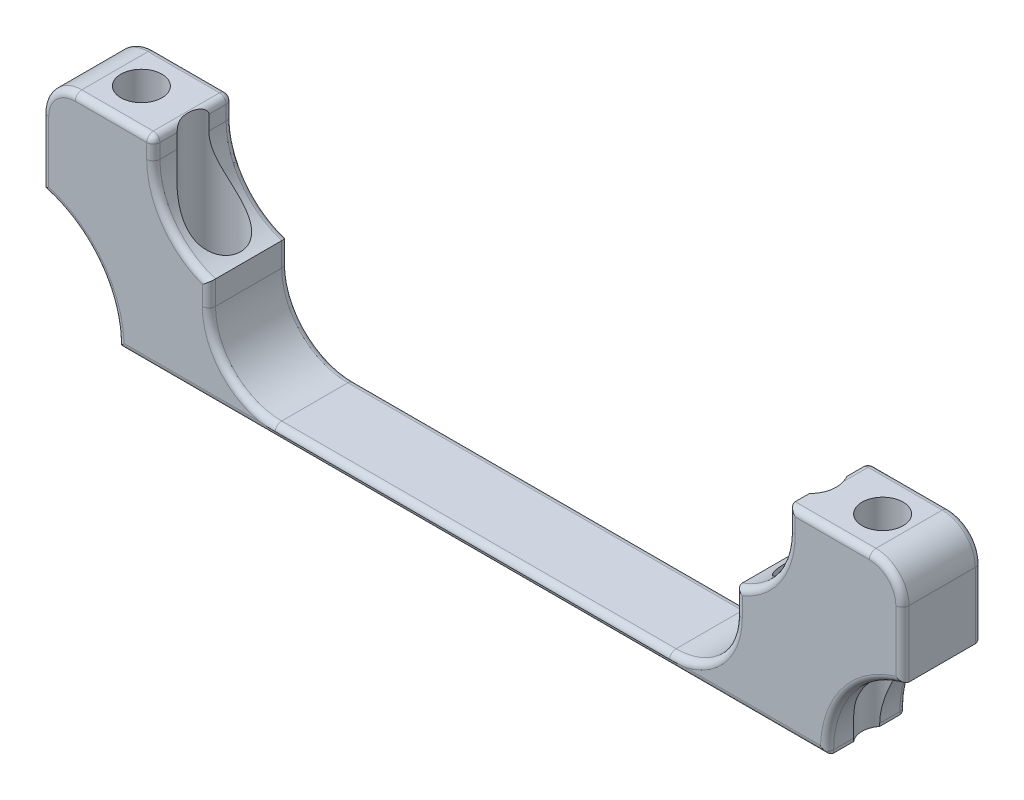
from build123d import *

# Parameters (mm, degrees)
SKETCH1_W           = 65
SKETCH1_H           = 6
SKETCH1_R           = 2
BOSS_EXTRUDE1_DEPTH = 15
SKETCH2_R           = 1.55
CUT_EXTRUDE1_DEPTH  = 36.920050111
SKETCH6_W           = 5.7
SKETCH6_H           = 7.5
SKETCH6_W_2         = 39.8
SKETCH6_H_2         = 6.8
CUT_EXTRUDE3_DEPTH  = 37.293938888
FILLET3_START       = 2.0000001
FILLET3_DEPTH       = 0.9999999
FILLET3_START_2     = -3
FILLET3_2_DEPTH     = 0.999999657
FILLET3_START_3     = -2.000000343
FILLET3_3_DEPTH     = 4.000000443
FILLET3_START_4     = 7.679241554
FILLET3_4_DEPTH     = 5.723635209
FILLET5_START       = 1.550000911
FILLET5_DEPTH       = 1.449999089
FILLET5_START_2     = -3
FILLET5_2_DEPTH     = 1.449996464
FILLET5_3_DEPTH     = 1.450229695
FILLET5_START_3     = -1.549770305
FILLET5_4_DEPTH     = 3.099771216
FILLET5_START_4     = -1.550003536
FILLET5_5_DEPTH     = 0.000233231
FILLET5_START_5     = -1e-07
FILLET5_6_DEPTH     = 7.5000001
FILLET9_R           = 5
FILLET10_R          = 2.5
FILLET11_R          = 0.5
FILLET13_R          = 0.5


with BuildPart() as part:
    # Sketch1 → Boss-Extrude1 (new body)
    with BuildSketch(Plane(origin=(0, 0, 0), x_dir=(1, 0, 0), z_dir=(0, 1, 0))):
        Rectangle(SKETCH1_W, SKETCH1_H)
        with Locations(Location((-22.5, 0, 0), (0, 0, 270))):
            Circle(SKETCH1_R, mode=Mode.SUBTRACT)
        with Locations(Location((22.5, 0, 0), (0, 0, 270))):
            Circle(SKETCH1_R, mode=Mode.SUBTRACT)
    extrude(amount=BOSS_EXTRUDE1_DEPTH)

    # Sketch2 → Cut-Extrude1 (cut, through all)
    with BuildSketch(Plane(origin=(0, 15, 0), x_dir=(1, 0, 0), z_dir=(0, 1, 0))):
        with Locations(Location((-28, 0, 0), (0, 0, 270))):
            Circle(SKETCH2_R)
        with Locations(Location((28, 0, 0), (0, 0, 270))):
            Circle(SKETCH2_R)
    extrude(amount=-CUT_EXTRUDE1_DEPTH, mode=Mode.SUBTRACT)

    # Sketch6 → Cut-Extrude3 (cut, through all)
    with BuildSketch(Plane.XY.offset(3)):
        with Locations((-29.65, 3.75)):
            Rectangle(SKETCH6_W, SKETCH6_H)
        Polygon((23.9, 15), (-24.1, 15), (-24.1, 7.679241554), (-19.9, 7.679241554), (19.9, 7.679241554), (23.9, 7.679241554), align=None)
        with Locations((0, 4.279241554)):
            Rectangle(SKETCH6_W_2, SKETCH6_H_2)
        with Locations((29.65, 3.75)):
            Rectangle(SKETCH6_W, SKETCH6_H)
    extrude(amount=-CUT_EXTRUDE3_DEPTH, mode=Mode.SUBTRACT)

    # Fillet3: read off the stored shape, not the designer's step
    # Fillet3 outline → Fillet3 (add)
    with BuildSketch(Plane.XY.offset(FILLET3_START)):
        with BuildLine():
            Line((-24.1, 7.679241554), (-19.9, 7.679241554))
            ThreePointArc((-19.9, 7.679241554), (-22.937354649, 9.853228893), (-24.1, 13.402876763))
            Line((-24.1, 13.402876763), (-24.1, 7.679241554))
        make_face()
        with BuildLine():
            Line((23.9, 7.679241554), (23.9, 13.336095804))
            ThreePointArc((23.9, 13.336095804), (22.798979486, 9.871994189), (19.9, 7.679241554))
            Line((19.9, 7.679241554), (23.9, 7.679241554))
        make_face()
    extrude(amount=FILLET3_DEPTH)

    # Fillet3 2 outline → Fillet3 2 (add)
    with BuildSketch(Plane.XY.offset(FILLET3_START_2)):
        with BuildLine():
            Line((-24.1, 7.679241554), (-19.9, 7.679241554))
            ThreePointArc((-19.9, 7.679241554), (-22.937354649, 9.853228893), (-24.1, 13.402876763))
            Line((-24.1, 13.402876763), (-24.1, 7.679241554))
        make_face()
        with BuildLine():
            Line((23.9, 7.679241554), (23.9, 13.336095804))
            ThreePointArc((23.9, 13.336095804), (22.798979486, 9.871994189), (19.9, 7.679241554))
            Line((19.9, 7.679241554), (23.9, 7.679241554))
        make_face()
    extrude(amount=FILLET3_2_DEPTH)

    # Fillet3 3 outline → Fillet3 3 (add)
    with BuildSketch(Plane.XY.offset(FILLET3_START_3)):
        with BuildLine():
            Line((-24.1, 7.679241554), (-19.9, 7.679241554))
            ThreePointArc((-19.9, 7.679241554), (-22.937354649, 9.853228893), (-24.1, 13.402876763))
            Line((-24.1, 13.402876763), (-24.1, 7.679241554))
        make_face()
        with BuildLine():
            Line((23.9, 7.679241554), (23.9, 13.336095804))
            ThreePointArc((23.9, 13.336095804), (22.798979486, 9.871994189), (19.9, 7.679241554))
            Line((19.9, 7.679241554), (23.9, 7.679241554))
        make_face()
    extrude(amount=FILLET3_3_DEPTH)

    # Fillet3 4 outline → Fillet3 4 (cut)
    with BuildSketch(Plane(origin=(0, 0, 0), x_dir=(1, 0, 0), z_dir=(0, 1, 0)).offset(FILLET3_START_4)):
        with BuildLine():
            Line((23.9, -1.428285686), (23.9, 1.428285686))
            ThreePointArc((23.9, 1.428285686), (20.5, 0), (23.9, -1.428285686))
        make_face()
        with BuildLine():
            Line((-24.1, 1.2), (-24.1, -1.2))
            ThreePointArc((-24.1, -1.2), (-20.5, 0), (-24.1, 1.2))
        make_face()
    extrude(amount=FILLET3_4_DEPTH, mode=Mode.SUBTRACT)

    # Fillet5: read off the stored shape, not the designer's step
    # Fillet5 outline → Fillet5 (add)
    with BuildSketch(Plane.XY.offset(FILLET5_START)):
        with BuildLine():
            ThreePointArc((26.8, 0.21920334), (28.394494094, 4.842513843), (32.5, 7.5))
            Line((32.5, 7.5), (26.8, 7.5))
            Line((26.8, 7.5), (26.8, 0.21920334))
        make_face()
        with BuildLine():
            ThreePointArc((-32.5, 7.5), (-28.394494094, 4.842513843), (-26.8, 0.21920334))
            Line((-26.8, 0.21920334), (-26.8, 7.5))
            Line((-26.8, 7.5), (-32.5, 7.5))
        make_face()
    extrude(amount=FILLET5_DEPTH)

    # Fillet5 2 outline → Fillet5 2 (add)
    with BuildSketch(Plane.XY.offset(FILLET5_START_2)):
        with BuildLine():
            ThreePointArc((26.8, 0.21920334), (28.394494094, 4.842513843), (32.5, 7.5))
            Line((32.5, 7.5), (26.8, 7.5))
            Line((26.8, 7.5), (26.8, 0.21920334))
        make_face()
        with BuildLine():
            ThreePointArc((-32.5, 7.5), (-28.394494094, 4.842513843), (-26.8, 0.21920334))
            Line((-26.8, 0.21920334), (-26.8, 7.5))
            Line((-26.8, 7.5), (-32.5, 7.5))
        make_face()
    extrude(amount=FILLET5_2_DEPTH)

    # Fillet5 3 outline → Fillet5 3 (add)
    with BuildSketch(Plane.XY.offset(FILLET5_START_2)):
        with BuildLine():
            ThreePointArc((26.8, 0.21920334), (28.394494094, 4.842513843), (32.5, 7.5))
            Line((32.5, 7.5), (26.8, 7.5))
            Line((26.8, 7.5), (26.8, 0.21920334))
        make_face()
    extrude(amount=FILLET5_3_DEPTH)

    # Fillet5 4 outline → Fillet5 4 (add)
    with BuildSketch(Plane.XY.offset(FILLET5_START_3)):
        with BuildLine():
            ThreePointArc((26.8, 0.21920334), (28.394494094, 4.842513843), (32.5, 7.5))
            Line((32.5, 7.5), (26.8, 7.5))
            Line((26.8, 7.5), (26.8, 0.21920334))
        make_face()
        with BuildLine():
            ThreePointArc((-32.5, 7.5), (-28.394494094, 4.842513843), (-26.8, 0.21920334))
            Line((-26.8, 0.21920334), (-26.8, 7.5))
            Line((-26.8, 7.5), (-32.5, 7.5))
        make_face()
    extrude(amount=FILLET5_4_DEPTH)

    # Fillet5 5 outline → Fillet5 5 (add)
    with BuildSketch(Plane.XY.offset(FILLET5_START_4)):
        with BuildLine():
            ThreePointArc((-32.5, 7.5), (-28.394494094, 4.842513843), (-26.8, 0.21920334))
            Line((-26.8, 0.21920334), (-26.8, 7.5))
            Line((-26.8, 7.5), (-32.5, 7.5))
        make_face()
    extrude(amount=FILLET5_5_DEPTH)

    # Fillet5 6 outline → Fillet5 6 (cut)
    with BuildSketch(Plane(origin=(0, 0, 0), x_dir=(1, 0, 0), z_dir=(0, 1, 0)).offset(FILLET5_START_5)):
        with BuildLine():
            ThreePointArc((26.8, -0.981070844), (29.55, 0), (26.8, 0.981070844))
            Line((26.8, 0.981070844), (26.8, -0.981070844))
        make_face()
        with BuildLine():
            Line((-26.8, -0.981070844), (-26.8, 0.981070844))
            ThreePointArc((-26.8, 0.981070844), (-29.55, 0), (-26.8, -0.981070844))
        make_face()
    extrude(amount=FILLET5_6_DEPTH, mode=Mode.SUBTRACT)

    # Fillet9
    fillet9_edges = [part.edges().sort_by_distance(p)[0] for p in [
        (-19.9, 0.879241554, 0),
        (19.9, 0.879241554, 0),
    ]]
    fillet(fillet9_edges, radius=FILLET9_R)

    # Fillet10
    fillet10_edges = [part.edges().sort_by_distance(p)[0] for p in [
        (32.5, 15, 0),
        (-32.5, 15, 0),
    ]]
    fillet(fillet10_edges, radius=FILLET10_R)

    # Fillet11
    # the kernel refuses this fillet: 0.5 mm, written as the material it takes off along each edge
    with BuildSketch(Plane(origin=(23.9, 15, -0.178285686), x_dir=(0, -1, 0), z_dir=(0, 0, -1))) as fillet11_piece_1:
        with BuildLine():
            CenterArc((FILLET11_R, -FILLET11_R), FILLET11_R, 90, 90)
            Line((0, -FILLET11_R), (0, 0))
            Line((0, 0), (FILLET11_R, 0))
        make_face()
    extrude(amount=4.071714314, mode=Mode.SUBTRACT)
    with BuildSketch(Plane(origin=(-24.1, 15, 0.05), x_dir=(-1, 0, 0), z_dir=(0, 0, -1)), Plane(origin=(-24.1, 15, 4.25), x_dir=(-1, 0, 0), z_dir=(0, 0, -1))) as fillet11_piece_2:
        with BuildLine():
            CenterArc((FILLET11_R, -FILLET11_R), FILLET11_R, 90, 90)
            Line((0, -FILLET11_R), (0, 0))
            Line((0, 0), (FILLET11_R, 0))
        make_face()
    extrude(amount=4.3, mode=Mode.SUBTRACT)

    # Fillet13
    # the kernel refuses this fillet: 0.5 mm, written as the material it takes off along each edge
    with BuildSketch(Plane(origin=(32.5, 6.25, -3), x_dir=(-1, 0, 0), z_dir=(0, 1, 0)), Plane(origin=(-32.5, 6.25, 3), x_dir=(1, 0, 0), z_dir=(0, 1, 0))) as fillet13_piece_1:
        with BuildLine():
            CenterArc((FILLET13_R, FILLET13_R), FILLET13_R, 180, 90)
            Line((0, FILLET13_R), (0, 0))
            Line((0, 0), (FILLET13_R, 0))
        make_face()
    extrude(amount=6.25, mode=Mode.SUBTRACT)
    with BuildSketch(Plane(origin=(30, 12.5, -3), x_dir=(0, 1, 0), z_dir=(-1, 0, 0))) as fillet13_piece_2:
        with BuildLine():
            CenterArc((2.5 - FILLET13_R, -FILLET13_R), FILLET13_R, 0, 90)
            Line((2.5, -FILLET13_R), (2.5, 0))
            Line((2.5, 0), (2.5 - FILLET13_R, 0))
        make_face()
    revolve(axis=Axis((30, 12.5, -3), (0, 0, -1)), revolution_arc=90, mode=Mode.SUBTRACT)
    with BuildSketch(Plane(origin=(24.4, 15, -3), x_dir=(0, -1, 0), z_dir=(1, 0, 0))) as fillet13_piece_3:
        with BuildLine():
            CenterArc((FILLET13_R, -FILLET13_R), FILLET13_R, 90, 90)
            Line((0, -FILLET13_R), (0, 0))
            Line((0, 0), (FILLET13_R, 0))
        make_face()
    extrude(amount=5.6, mode=Mode.SUBTRACT)
    with BuildSketch(Plane(origin=(24.4, 14.5, -3), x_dir=(0, 1, 0), z_dir=(1, 0, 0))) as fillet13_piece_4:
        with BuildLine():
            CenterArc((0.5 - FILLET13_R, FILLET13_R), FILLET13_R, 270, 90)
            Line((0.5, FILLET13_R), (0.5, 0))
            Line((0.5, 0), (0.5 - FILLET13_R, 0))
        make_face()
    revolve(axis=Axis((24.4, 14.5, -3), (0, 0, 1)), revolution_arc=90, mode=Mode.SUBTRACT)
    with BuildSketch(Plane(origin=(23.9, 14.5, -3), x_dir=(1, 0, 0), z_dir=(0, -1, 0))) as fillet13_piece_5:
        with BuildLine():
            CenterArc((FILLET13_R, FILLET13_R), FILLET13_R, 180, 90)
            Line((0, FILLET13_R), (0, 0))
            Line((0, 0), (FILLET13_R, 0))
        make_face()
    extrude(amount=1.163904196, mode=Mode.SUBTRACT)
    with BuildSketch(Plane(origin=(17.9, 13.336095804, -3), x_dir=(1.0, 7.488202650441486e-11, 0), z_dir=(-7.488202650441486e-11, 1.0, 0))) as fillet13_piece_6:
        with BuildLine():
            CenterArc((6 + FILLET13_R, -FILLET13_R), FILLET13_R, 90, 90)
            Line((6, -FILLET13_R), (6, 0))
            Line((6, 0), (6 + FILLET13_R, 0))
        make_face()
    revolve(axis=Axis((17.9, 13.336095804, -3), (0, 0, -1)), revolution_arc=82.468344473, mode=Mode.SUBTRACT)
    with BuildSketch(Plane(origin=(19.9, 8.929241554, -3), x_dir=(1, 0, 0), z_dir=(0, -1, 0)), Plane(origin=(-19.9, 5.879241554, -3), x_dir=(-1, 0, 0), z_dir=(0, 1, 0)), Plane(origin=(-19.9, 8.929241554, 3), x_dir=(-1, 0, 0), z_dir=(0, -1, 0)), Plane(origin=(19.9, 5.879241554, 3), x_dir=(1, 0, 0), z_dir=(0, 1, 0))) as fillet13_piece_7:
        with BuildLine():
            CenterArc((FILLET13_R, FILLET13_R), FILLET13_R, 180, 90)
            Line((0, FILLET13_R), (0, 0))
            Line((0, 0), (FILLET13_R, 0))
        make_face()
    extrude(amount=3.05, mode=Mode.SUBTRACT)
    with BuildSketch(Plane(origin=(14.9, 5.879241554, -3), x_dir=(0, -1, 0), z_dir=(-1, 0, 0))) as fillet13_piece_8:
        with BuildLine():
            CenterArc((5 + FILLET13_R, FILLET13_R), FILLET13_R, 180, 90)
            Line((5, FILLET13_R), (5, 0))
            Line((5, 0), (5 + FILLET13_R, 0))
        make_face()
    revolve(axis=Axis((14.9, 5.879241554, -3), (0, 0, 1)), revolution_arc=90, mode=Mode.SUBTRACT)
    with BuildSketch(Plane(origin=(14.9, 0.879241554, -3), x_dir=(0, -1, 0), z_dir=(-1, 0, 0)), Plane(origin=(-14.9, 0.879241554, 3), x_dir=(0, -1, 0), z_dir=(1, 0, 0))) as fillet13_piece_9:
        with BuildLine():
            CenterArc((FILLET13_R, FILLET13_R), FILLET13_R, 180, 90)
            Line((0, FILLET13_R), (0, 0))
            Line((0, 0), (FILLET13_R, 0))
        make_face()
    extrude(amount=29.8, mode=Mode.SUBTRACT)
    with BuildSketch(Plane(origin=(-14.9, 5.879241554, -3), x_dir=(-1, 0, 0), z_dir=(0, 1, 0))) as fillet13_piece_10:
        with BuildLine():
            CenterArc((5 + FILLET13_R, FILLET13_R), FILLET13_R, 180, 90)
            Line((5, FILLET13_R), (5, 0))
            Line((5, 0), (5 + FILLET13_R, 0))
        make_face()
    revolve(axis=Axis((-14.9, 5.879241554, -3), (0, 0, 1)), revolution_arc=90, mode=Mode.SUBTRACT)
    with BuildSketch(Plane(origin=(-18.099999999, 13.402876763, -3), x_dir=(-0.09615615837248713, -0.9953662608341942, 0), z_dir=(0.9953662608341942, -0.09615615837248713, 0))) as fillet13_piece_11:
        with BuildLine():
            CenterArc((6.000000001 + FILLET13_R, -FILLET13_R), FILLET13_R, 90, 90)
            Line((6.000000001, -FILLET13_R), (6.000000001, 0))
            Line((6.000000001, 0), (6.000000001 + FILLET13_R, 0))
        make_face()
    revolve(axis=Axis((-18.099999999, 13.402876763, -3), (0, 0, -1)), revolution_arc=84.482132528, mode=Mode.SUBTRACT)
    with BuildSketch(Plane(origin=(-24.1, 13.402876763, -3), x_dir=(-1, 0, 0), z_dir=(0, 1, 0)), Plane(origin=(-24.1, 14.5, 3), x_dir=(-1, 0, 0), z_dir=(0, -1, 0))) as fillet13_piece_12:
        with BuildLine():
            CenterArc((FILLET13_R, FILLET13_R), FILLET13_R, 180, 90)
            Line((0, FILLET13_R), (0, 0))
            Line((0, 0), (FILLET13_R, 0))
        make_face()
    extrude(amount=1.097123237, mode=Mode.SUBTRACT)
    with BuildSketch(Plane(origin=(-24.6, 14.5, -3), x_dir=(1, 0, 0), z_dir=(0, -1, 0))) as fillet13_piece_13:
        with BuildLine():
            CenterArc((0.5 - FILLET13_R, FILLET13_R), FILLET13_R, 270, 90)
            Line((0.5, FILLET13_R), (0.5, 0))
            Line((0.5, 0), (0.5 - FILLET13_R, 0))
        make_face()
    revolve(axis=Axis((-24.6, 14.5, -3), (0, 0, 1)), revolution_arc=90, mode=Mode.SUBTRACT)
    with BuildSketch(Plane(origin=(-30, 15, -3), x_dir=(0, -1, 0), z_dir=(1, 0, 0))) as fillet13_piece_14:
        with BuildLine():
            CenterArc((FILLET13_R, -FILLET13_R), FILLET13_R, 90, 90)
            Line((0, -FILLET13_R), (0, 0))
            Line((0, 0), (FILLET13_R, 0))
        make_face()
    extrude(amount=5.4, mode=Mode.SUBTRACT)
    with BuildSketch(Plane(origin=(-30, 12.5, -3), x_dir=(0, 1, 0), z_dir=(1, 0, 0))) as fillet13_piece_15:
        with BuildLine():
            CenterArc((2.5 - FILLET13_R, FILLET13_R), FILLET13_R, 270, 90)
            Line((2.5, FILLET13_R), (2.5, 0))
            Line((2.5, 0), (2.5 - FILLET13_R, 0))
        make_face()
    revolve(axis=Axis((-30, 12.5, -3), (0, 0, 1)), revolution_arc=90, mode=Mode.SUBTRACT)
    with BuildSketch(Plane(origin=(-32.5, 6.25, -3), x_dir=(1, 0, 0), z_dir=(0, 1, 0)), Plane(origin=(32.5, 6.25, 3), x_dir=(-1, 0, 0), z_dir=(0, 1, 0))) as fillet13_piece_16:
        with BuildLine():
            CenterArc((FILLET13_R, -FILLET13_R), FILLET13_R, 90, 90)
            Line((0, -FILLET13_R), (0, 0))
            Line((0, 0), (FILLET13_R, 0))
        make_face()
    extrude(amount=6.25, mode=Mode.SUBTRACT)
    with BuildSketch(Plane(origin=(-34.299999997, 0.219203342, -3), x_dir=(0.0755791635302137, 0.997139804661349, 0), z_dir=(-0.997139804661349, 0.0755791635302137, 0))) as fillet13_piece_17:
        with BuildLine():
            CenterArc((7.499999997 + FILLET13_R, -FILLET13_R), FILLET13_R, 90, 90)
            Line((7.499999997, -FILLET13_R), (7.499999997, 0))
            Line((7.499999997, 0), (7.499999997 + FILLET13_R, 0))
        make_face()
    revolve(axis=Axis((-34.299999997, 0.219203342, -3), (0, 0, -1)), revolution_arc=85.665499633, mode=Mode.SUBTRACT)
    with BuildSketch(Plane(origin=(-28.05, 0, -3), x_dir=(0, 1, 0), z_dir=(1, 0, 0)), Plane(origin=(28.05, 0, 3), x_dir=(0, 1, 0), z_dir=(-1, 0, 0))) as fillet13_piece_18:
        with BuildLine():
            CenterArc((FILLET13_R, FILLET13_R), FILLET13_R, 180, 90)
            Line((0, FILLET13_R), (0, 0))
            Line((0, 0), (FILLET13_R, 0))
        make_face()
    extrude(amount=56.1, mode=Mode.SUBTRACT)
    with BuildSketch(Plane(origin=(34.299999997, 0.219203342, -3), x_dir=(-1.0, -3.030311669283442e-10, 0), z_dir=(3.030311669283442e-10, -1.0, 0))) as fillet13_piece_19:
        with BuildLine():
            CenterArc((7.499999997 + FILLET13_R, -FILLET13_R), FILLET13_R, 90, 90)
            Line((7.499999997, -FILLET13_R), (7.499999997, 0))
            Line((7.499999997, 0), (7.499999997 + FILLET13_R, 0))
        make_face()
    revolve(axis=Axis((34.299999997, 0.219203342, -3), (0, 0, -1)), revolution_arc=85.665499633, mode=Mode.SUBTRACT)
    with BuildSketch(Plane(origin=(-34.299999997, 0.219203342, 3), x_dir=(0.07557916353021274, 0.997139804661349, 0), z_dir=(-0.997139804661349, 0.07557916353021274, 0))) as fillet13_piece_20:
        with BuildLine():
            CenterArc((7.499999997 + FILLET13_R, FILLET13_R), FILLET13_R, 180, 90)
            Line((7.499999997, FILLET13_R), (7.499999997, 0))
            Line((7.499999997, 0), (7.499999997 + FILLET13_R, 0))
        make_face()
    revolve(axis=Axis((-34.299999997, 0.219203342, 3), (0, 0, -1)), revolution_arc=85.665499633, mode=Mode.SUBTRACT)
    with BuildSketch(Plane(origin=(-30, 12.5, 3), x_dir=(0, 1, 0), z_dir=(1, 0, 0))) as fillet13_piece_21:
        with BuildLine():
            CenterArc((2.5 - FILLET13_R, -FILLET13_R), FILLET13_R, 0, 90)
            Line((2.5, -FILLET13_R), (2.5, 0))
            Line((2.5, 0), (2.5 - FILLET13_R, 0))
        make_face()
    revolve(axis=Axis((-30, 12.5, 3), (0, 0, 1)), revolution_arc=90, mode=Mode.SUBTRACT)
    with BuildSketch(Plane(origin=(-24.6, 15, 3), x_dir=(0, 0, -1), z_dir=(-1, 0, 0))) as fillet13_piece_22:
        with BuildLine():
            CenterArc((FILLET13_R, FILLET13_R), FILLET13_R, 180, 90)
            Line((0, FILLET13_R), (0, 0))
            Line((0, 0), (FILLET13_R, 0))
        make_face()
    extrude(amount=5.4, mode=Mode.SUBTRACT)
    with BuildSketch(Plane(origin=(-24.6, 14.5, 3), x_dir=(1, 0, 0), z_dir=(0, -1, 0))) as fillet13_piece_23:
        with BuildLine():
            CenterArc((0.5 - FILLET13_R, -FILLET13_R), FILLET13_R, 0, 90)
            Line((0.5, -FILLET13_R), (0.5, 0))
            Line((0.5, 0), (0.5 - FILLET13_R, 0))
        make_face()
    revolve(axis=Axis((-24.6, 14.5, 3), (0, 0, 1)), revolution_arc=90, mode=Mode.SUBTRACT)
    with BuildSketch(Plane(origin=(-18.099999999, 13.402876763, 3), x_dir=(-0.09615615837248773, -0.9953662608341942, 0), z_dir=(0.9953662608341942, -0.09615615837248773, 0))) as fillet13_piece_24:
        with BuildLine():
            CenterArc((6.000000001 + FILLET13_R, FILLET13_R), FILLET13_R, 180, 90)
            Line((6.000000001, FILLET13_R), (6.000000001, 0))
            Line((6.000000001, 0), (6.000000001 + FILLET13_R, 0))
        make_face()
    revolve(axis=Axis((-18.099999999, 13.402876763, 3), (0, 0, -1)), revolution_arc=84.482132528, mode=Mode.SUBTRACT)
    with BuildSketch(Plane(origin=(-14.9, 5.879241554, 3), x_dir=(-1, 0, 0), z_dir=(0, 1, 0))) as fillet13_piece_25:
        with BuildLine():
            CenterArc((5 + FILLET13_R, -FILLET13_R), FILLET13_R, 90, 90)
            Line((5, -FILLET13_R), (5, 0))
            Line((5, 0), (5 + FILLET13_R, 0))
        make_face()
    revolve(axis=Axis((-14.9, 5.879241554, 3), (0, 0, 1)), revolution_arc=90, mode=Mode.SUBTRACT)
    with BuildSketch(Plane(origin=(14.9, 5.879241554, 3), x_dir=(0, -1, 0), z_dir=(-1, 0, 0))) as fillet13_piece_26:
        with BuildLine():
            CenterArc((5 + FILLET13_R, -FILLET13_R), FILLET13_R, 90, 90)
            Line((5, -FILLET13_R), (5, 0))
            Line((5, 0), (5 + FILLET13_R, 0))
        make_face()
    revolve(axis=Axis((14.9, 5.879241554, 3), (0, 0, 1)), revolution_arc=90, mode=Mode.SUBTRACT)
    with BuildSketch(Plane(origin=(17.9, 13.336095804, 3), x_dir=(1.0, 7.488202650441486e-11, 0), z_dir=(-7.488202650441486e-11, 1.0, 0))) as fillet13_piece_27:
        with BuildLine():
            CenterArc((6 + FILLET13_R, FILLET13_R), FILLET13_R, 180, 90)
            Line((6, FILLET13_R), (6, 0))
            Line((6, 0), (6 + FILLET13_R, 0))
        make_face()
    revolve(axis=Axis((17.9, 13.336095804, 3), (0, 0, -1)), revolution_arc=82.468344473, mode=Mode.SUBTRACT)
    with BuildSketch(Plane(origin=(23.9, 13.336095804, 3), x_dir=(1, 0, 0), z_dir=(0, 1, 0))) as fillet13_piece_28:
        with BuildLine():
            CenterArc((FILLET13_R, FILLET13_R), FILLET13_R, 180, 90)
            Line((0, FILLET13_R), (0, 0))
            Line((0, 0), (FILLET13_R, 0))
        make_face()
    extrude(amount=2.913904196, mode=Mode.SUBTRACT)
    with BuildSketch(Plane(origin=(30, 15, 3), x_dir=(0, -1, 0), z_dir=(-1, 0, 0))) as fillet13_piece_29:
        with BuildLine():
            CenterArc((FILLET13_R, -FILLET13_R), FILLET13_R, 90, 90)
            Line((0, -FILLET13_R), (0, 0))
            Line((0, 0), (FILLET13_R, 0))
        make_face()
    extrude(amount=7.35, mode=Mode.SUBTRACT)
    with BuildSketch(Plane(origin=(30, 12.5, 3), x_dir=(0, 1, 0), z_dir=(-1, 0, 0))) as fillet13_piece_30:
        with BuildLine():
            CenterArc((2.5 - FILLET13_R, FILLET13_R), FILLET13_R, 270, 90)
            Line((2.5, FILLET13_R), (2.5, 0))
            Line((2.5, 0), (2.5 - FILLET13_R, 0))
        make_face()
    revolve(axis=Axis((30, 12.5, 3), (0, 0, -1)), revolution_arc=90, mode=Mode.SUBTRACT)
    with BuildSketch(Plane(origin=(34.299999997, 0.219203342, 3), x_dir=(-1.0, -3.030311669283442e-10, 0), z_dir=(3.030311669283442e-10, -1.0, 0))) as fillet13_piece_31:
        with BuildLine():
            CenterArc((7.499999997 + FILLET13_R, FILLET13_R), FILLET13_R, 180, 90)
            Line((7.499999997, FILLET13_R), (7.499999997, 0))
            Line((7.499999997, 0), (7.499999997 + FILLET13_R, 0))
        make_face()
    revolve(axis=Axis((34.299999997, 0.219203342, 3), (0, 0, -1)), revolution_arc=85.665499633, mode=Mode.SUBTRACT)
    with BuildSketch(Plane(origin=(26.8, 0.21920334, 3), x_dir=(-1, 0, 0), z_dir=(0, -1, 0)), Plane(origin=(26.8, -1.25, -3), x_dir=(-1, 0, 0), z_dir=(0, 1, 0)), Plane(origin=(-26.8, 0.21920334, -3), x_dir=(1, 0, 0), z_dir=(0, -1, 0))) as fillet13_piece_32:
        with BuildLine():
            CenterArc((FILLET13_R, FILLET13_R), FILLET13_R, 180, 90)
            Line((0, FILLET13_R), (0, 0))
            Line((0, 0), (FILLET13_R, 0))
        make_face()
    extrude(amount=1.46920334, mode=Mode.SUBTRACT)
    with BuildSketch(Plane(origin=(-26.8, -1.25, 3), x_dir=(0, 0, -1), z_dir=(0, 1, 0))) as fillet13_piece_33:
        with BuildLine():
            CenterArc((FILLET13_R, -FILLET13_R), FILLET13_R, 90, 90)
            Line((0, -FILLET13_R), (0, 0))
            Line((0, 0), (FILLET13_R, 0))
        make_face()
    extrude(amount=1.46920334, mode=Mode.SUBTRACT)


solid = part.part
